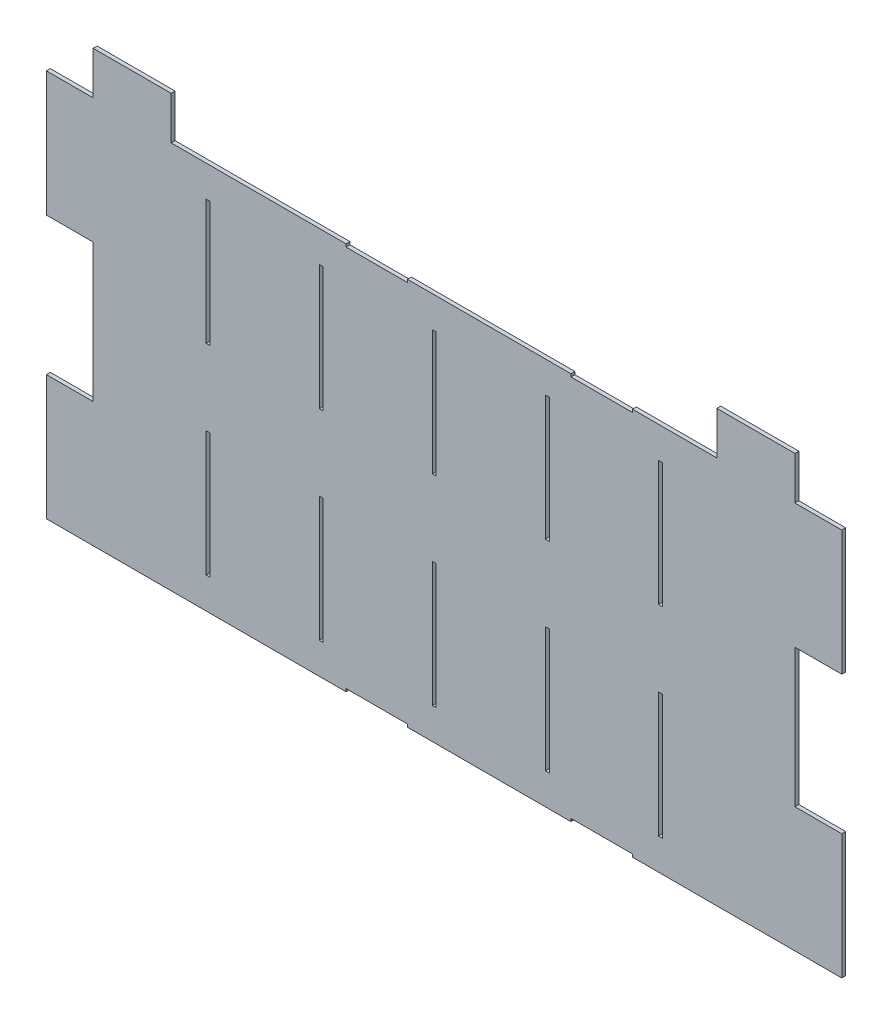
from build123d import *

# Parameters (mm, degrees)
SKETCH1_W                 = 570.860988324
SKETCH1_H                 = 315.575
BOSS_EXTRUDE1_DEPTH       = 3.175
SKETCH2_W                 = 3.175
SKETCH2_H                 = 101.6
CUT_EXTRUDE1_DEPTH        = 3.175
SKETCH7_W                 = 50
SKETCH7_H                 = 2.286
CUT_EXTRUDE5_DEPTH        = 3.175
LPATTERN2_COPY_1_SKETCH_W = 3.175
LPATTERN2_COPY_1_SKETCH_H = 101.6
LPATTERN2_COPY_1_DEPTH    = 3.175
LPATTERN2_COPY_2_SKETCH_W = 3.175
LPATTERN2_COPY_2_SKETCH_H = 101.6
LPATTERN2_COPY_2_DEPTH    = 3.175
LPATTERN2_COPY_3_SKETCH_W = 3.175
LPATTERN2_COPY_3_SKETCH_H = 101.6
LPATTERN2_COPY_3_DEPTH    = 3.175
LPATTERN2_COPY_4_SKETCH_W = 3.175
LPATTERN2_COPY_4_SKETCH_H = 101.6
LPATTERN2_COPY_4_DEPTH    = 3.175
LPATTERN2_COPY_5_SKETCH_W = 3.175
LPATTERN2_COPY_5_SKETCH_H = 101.6
LPATTERN2_COPY_5_DEPTH    = 3.175
LPATTERN2_COPY_6_SKETCH_W = 3.175
LPATTERN2_COPY_6_SKETCH_H = 101.6
LPATTERN2_COPY_6_DEPTH    = 3.175
LPATTERN2_COPY_7_SKETCH_W = 3.175
LPATTERN2_COPY_7_SKETCH_H = 101.6
LPATTERN2_COPY_7_DEPTH    = 3.175
LPATTERN2_COPY_8_SKETCH_W = 3.175
LPATTERN2_COPY_8_SKETCH_H = 101.6
LPATTERN2_COPY_8_DEPTH    = 3.175
SKETCH9_W                 = 63.5
SKETCH9_H                 = 34.925
SKETCH9_W_2               = 38.1
SKETCH9_H_2               = 101.6
BOSS_EXTRUDE3_DEPTH       = 3.175


with BuildPart() as part:
    # Sketch1 → Boss-Extrude1 (new body)
    with BuildSketch(Plane.XY):
        Rectangle(SKETCH1_W, SKETCH1_H)
    extrude(amount=BOSS_EXTRUDE1_DEPTH)

    # Sketch2 → Cut-Extrude1 (cut)
    with BuildSketch(Plane.XY.offset(3.175)):
        with Locations((-191.887994162, -81.5875)):
            Rectangle(SKETCH2_W, SKETCH2_H)
    cut_extrude1 = extrude(amount=-CUT_EXTRUDE1_DEPTH, mode=Mode.SUBTRACT)

    # Sketch7 → Cut-Extrude5 (cut)
    with BuildSketch(Plane.XY.offset(3.175)):
        with Locations((128.2695, -156.6445)):
            Rectangle(SKETCH7_W, SKETCH7_H)
        with Locations((-54.7305, -156.6445)):
            Rectangle(SKETCH7_W, SKETCH7_H)
    cut_extrude5 = extrude(amount=-CUT_EXTRUDE5_DEPTH, mode=Mode.SUBTRACT)

    # Mirror3: Cut-Extrude1 across plane
    add(cut_extrude1.mirror(Plane.ZX), mode=Mode.SUBTRACT)

    # LPattern2 copy 1 sketch → LPattern2 copy 1 (cut)
    with BuildSketch(Plane(origin=(91.96, 0, 3.175), x_dir=(1, 0, 0), z_dir=(0, 0, 1))):
        with Locations((-191.887994162, 81.5875)):
            Rectangle(LPATTERN2_COPY_1_SKETCH_W, LPATTERN2_COPY_1_SKETCH_H)
    extrude(amount=-LPATTERN2_COPY_1_DEPTH, mode=Mode.SUBTRACT)

    # LPattern2 copy 2 sketch → LPattern2 copy 2 (cut)
    with BuildSketch(Plane(origin=(183.92, 0, 3.175), x_dir=(1, 0, 0), z_dir=(0, 0, 1))):
        with Locations((-191.887994162, 81.5875)):
            Rectangle(LPATTERN2_COPY_2_SKETCH_W, LPATTERN2_COPY_2_SKETCH_H)
    extrude(amount=-LPATTERN2_COPY_2_DEPTH, mode=Mode.SUBTRACT)

    # LPattern2 copy 3 sketch → LPattern2 copy 3 (cut)
    with BuildSketch(Plane(origin=(275.88, 0, 3.175), x_dir=(1, 0, 0), z_dir=(0, 0, 1))):
        with Locations((-191.887994162, 81.5875)):
            Rectangle(LPATTERN2_COPY_3_SKETCH_W, LPATTERN2_COPY_3_SKETCH_H)
    extrude(amount=-LPATTERN2_COPY_3_DEPTH, mode=Mode.SUBTRACT)

    # LPattern2 copy 4 sketch → LPattern2 copy 4 (cut)
    with BuildSketch(Plane(origin=(367.84, 0, 3.175), x_dir=(1, 0, 0), z_dir=(0, 0, 1))):
        with Locations((-191.887994162, 81.5875)):
            Rectangle(LPATTERN2_COPY_4_SKETCH_W, LPATTERN2_COPY_4_SKETCH_H)
    extrude(amount=-LPATTERN2_COPY_4_DEPTH, mode=Mode.SUBTRACT)

    # LPattern2 copy 5 sketch → LPattern2 copy 5 (cut)
    with BuildSketch(Plane(origin=(91.96, 0, 3.175), x_dir=(1, 0, 0), z_dir=(0, 0, 1))):
        with Locations((-191.887994162, -81.5875)):
            Rectangle(LPATTERN2_COPY_5_SKETCH_W, LPATTERN2_COPY_5_SKETCH_H)
    extrude(amount=-LPATTERN2_COPY_5_DEPTH, mode=Mode.SUBTRACT)

    # LPattern2 copy 6 sketch → LPattern2 copy 6 (cut)
    with BuildSketch(Plane(origin=(183.92, 0, 3.175), x_dir=(1, 0, 0), z_dir=(0, 0, 1))):
        with Locations((-191.887994162, -81.5875)):
            Rectangle(LPATTERN2_COPY_6_SKETCH_W, LPATTERN2_COPY_6_SKETCH_H)
    extrude(amount=-LPATTERN2_COPY_6_DEPTH, mode=Mode.SUBTRACT)

    # LPattern2 copy 7 sketch → LPattern2 copy 7 (cut)
    with BuildSketch(Plane(origin=(275.88, 0, 3.175), x_dir=(1, 0, 0), z_dir=(0, 0, 1))):
        with Locations((-191.887994162, -81.5875)):
            Rectangle(LPATTERN2_COPY_7_SKETCH_W, LPATTERN2_COPY_7_SKETCH_H)
    extrude(amount=-LPATTERN2_COPY_7_DEPTH, mode=Mode.SUBTRACT)

    # LPattern2 copy 8 sketch → LPattern2 copy 8 (cut)
    with BuildSketch(Plane(origin=(367.84, 0, 3.175), x_dir=(1, 0, 0), z_dir=(0, 0, 1))):
        with Locations((-191.887994162, -81.5875)):
            Rectangle(LPATTERN2_COPY_8_SKETCH_W, LPATTERN2_COPY_8_SKETCH_H)
    extrude(amount=-LPATTERN2_COPY_8_DEPTH, mode=Mode.SUBTRACT)

    # Sketch9 → Boss-Extrude3 (add)
    with BuildSketch(Plane(origin=(0, 0, 0), x_dir=(-1, 0, 0), z_dir=(0, 0, -1))):
        with Locations((-253.680494162, 175.25)):
            Rectangle(SKETCH9_W, SKETCH9_H)
        Polygon((-285.430494162, 56.1875), (-285.430494162, 157.7875), (-304.480494162, 157.7875), (-323.530494162, 157.7875), (-323.530494162, 56.1875), align=None)
        with Locations((-304.480494162, -106.9875)):
            Rectangle(SKETCH9_W_2, SKETCH9_H_2)
    boss_extrude3 = extrude(amount=-BOSS_EXTRUDE3_DEPTH)

    # Mirror4: Boss-Extrude3 across plane
    add(boss_extrude3.mirror(Plane(origin=(0, 0, 0), x_dir=(0, 0, 1), z_dir=(1, 0, 0))))

    # Mirror5: Cut-Extrude5 across plane
    add(cut_extrude5.mirror(Plane.ZX), mode=Mode.SUBTRACT)


solid = part.part
